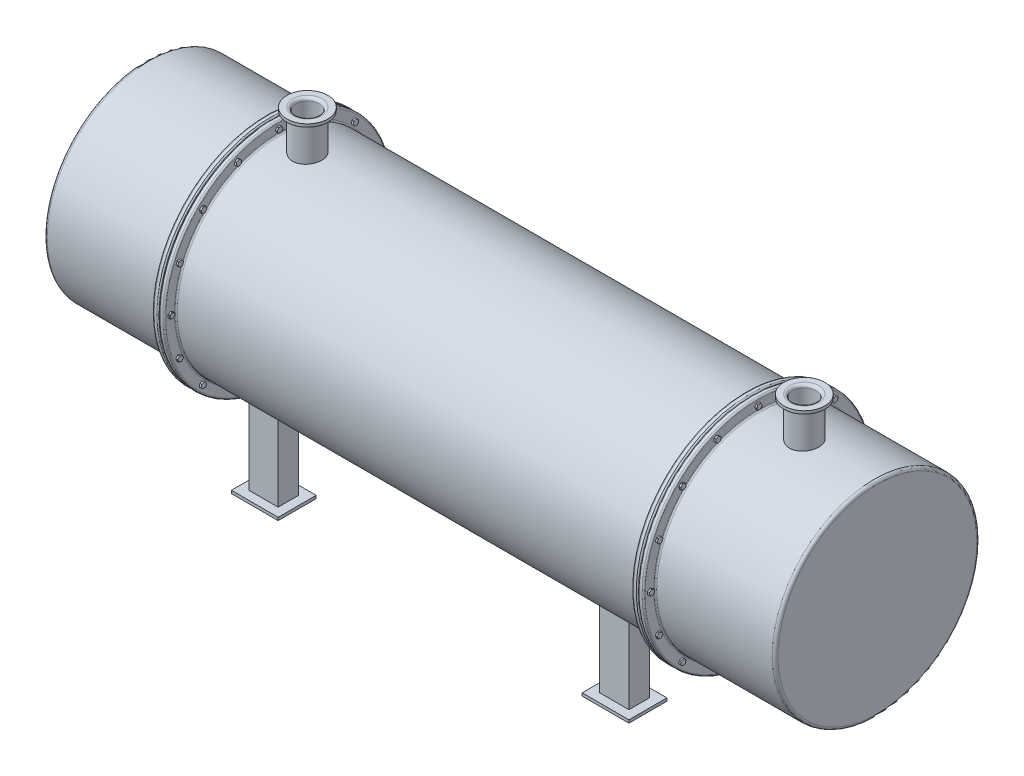
from build123d import *

# Parameters (mm, degrees)
BOSS_EXTRUDE1_DEPTH      = 1250
BOSS_EXTRUDE1_DEPTH_BACK = 1250
SKETCH1_R                = 350
BOSS_EXTRUDE2_START      = 800
SKETCH2_R                = 390
BOSS_EXTRUDE2_DEPTH      = 20
FILLET1_R                = 5
BOSS_EXTRUDE3_DEPTH      = 6
FILLET2_R                = 1
CIRPATTERN1_COUNT        = 16
MIRROR3_START            = 824.9999999
MIRROR3_OUTLINE_R        = 390
MIRROR3_DEPTH            = 10
MIRROR3_START_2          = 820
MIRROR3_2_DEPTH          = 26
FILLET4_R                = 10
SKETCH5_W                = 100
SKETCH5_H                = 70
BOSS_EXTRUDE4_DEPTH      = 503
SKETCH6_W                = 160
SKETCH6_H                = 130
BOSS_EXTRUDE5_DEPTH      = 10
MIRROR13_COPY_1_SKETCH_W = 100
MIRROR13_COPY_1_SKETCH_H = 70
MIRROR13_COPY_1_DEPTH    = 503
MIRROR13_COPY_2_SKETCH_W = 160
MIRROR13_COPY_2_SKETCH_H = 130
MIRROR13_COPY_2_DEPTH    = 10
SKETCH7_R                = 50
SKETCH7_R_2              = 40
BOSS_EXTRUDE6_DEPTH      = 472
SKETCH8_R                = 70
SKETCH8_R_2              = 40
BOSS_EXTRUDE7_DEPTH      = 10
FILLET5_R                = 10
FILLET5_OF_MIRROR18_R    = 10
SKETCH9_R                = 35
SKETCH9_R_2              = 25
BOSS_EXTRUDE8_DEPTH      = 476
SKETCH10_R               = 60
SKETCH10_R_2             = 50
BOSS_EXTRUDE9_DEPTH      = 450
SCALE2_SCALE             = 0.8


with BuildPart() as part:
    # Sketch1 → Boss-Extrude1 (new, two sides: drawn at the far end of the back side and taken through both)
    with BuildSketch(Plane(origin=(0, 0, 0), x_dir=(0, 0, -1), z_dir=(1, 0, 0)).offset(-BOSS_EXTRUDE1_DEPTH_BACK)):
        Circle(SKETCH1_R)
    extrude(amount=BOSS_EXTRUDE1_DEPTH + BOSS_EXTRUDE1_DEPTH_BACK)

    # Sketch2 → Boss-Extrude2 (add)
    with BuildSketch(Plane(origin=(0, 0, 0), x_dir=(0, 0, -1), z_dir=(1, 0, 0)).offset(BOSS_EXTRUDE2_START)):
        Circle(SKETCH2_R)
    extrude(amount=BOSS_EXTRUDE2_DEPTH)

    # Fillet1
    fillet1_edges = [part.edges().sort_by_distance(p)[0] for p in [
        (800, 0, 350),
        (800, 0, 390),
        (820, 0, 390),
    ]]
    fillet(fillet1_edges, radius=FILLET1_R)

    # Sketch4 → Boss-Extrude3 (add)
    with BuildSketch(Plane.ZY.offset(-800)):
        Polygon((376.160254038, -4.451318161), (376.160254038, 5.548681839), (367.5, 10.548681839), (358.839745962, 5.548681839), (358.839745962, -4.451318161), (367.5, -9.451318161), align=None)
    boss_extrude3 = extrude(amount=BOSS_EXTRUDE3_DEPTH)

    # Fillet2
    fillet2_edges = [part.edges().sort_by_distance(p)[0] for p in [
        (794, -6.951318161, 371.830127019),
        (794, 0.548681839, 376.160254038),
        (794, 8.048681839, 371.830127019),
        (794, 8.048681839, 363.169872981),
        (794, 0.548681839, 358.839745962),
        (794, -6.951318161, 363.169872981),
    ]]
    fillet(fillet2_edges, radius=FILLET2_R)

    # CirPattern1: Boss-Extrude3 ×16 about axis
    cirpattern1_axis = Axis((0, 0, 0), (1, 0, 0))
    for i in range(1, CIRPATTERN1_COUNT):
        add(boss_extrude3.rotate(cirpattern1_axis, i * 360 / CIRPATTERN1_COUNT))

    # Mirror3: read off the stored shape, not the designer's step
    # Mirror3 outline → Mirror3 (add)
    with BuildSketch(Plane.YZ.offset(MIRROR3_START)):
        Circle(MIRROR3_OUTLINE_R)
    extrude(amount=MIRROR3_DEPTH)

    # Mirror3 2 outline → Mirror3 2 (add)
    with BuildSketch(Plane.YZ.offset(MIRROR3_START_2)):
        Polygon((5.548681839, 376.160254038), (-4.451318161, 376.160254038), (-9.451318161, 367.5), (-4.451318161, 358.839745962), (5.548681839, 358.839745962), (10.548681839, 367.5), align=None)
        Polygon((-138.823983551, 349.650148261), (-148.062778876, 345.823313937), (-149.368040798, 335.908865324), (-141.434507395, 329.821251034), (-132.19571207, 333.648085357), (-130.890450148, 343.562533971), align=None)
        Polygon((-262.061955888, 269.908976998), (-269.1330237, 262.837909186), (-266.544833249, 253.178650923), (-256.885574986, 250.590460472), (-249.814507174, 257.661528284), (-252.402697625, 267.320786547), align=None)
        Polygon((-345.403371038, 149.076610718), (-349.230205362, 139.837815393), (-343.142591072, 131.90428199), (-333.228142458, 133.209543912), (-329.401308135, 142.448339237), (-335.488922425, 150.38187264), align=None)
        Polygon((-376.160254038, 5.548681839), (-376.160254038, -4.451318161), (-367.5, -9.451318161), (-358.839745962, -4.451318161), (-358.839745962, 5.548681839), (-367.5, 10.548681839), align=None)
        Polygon((-349.650148261, -138.823983551), (-345.823313937, -148.062778876), (-335.908865324, -149.368040798), (-329.821251034, -141.434507395), (-333.648085357, -132.19571207), (-343.562533971, -130.890450148), align=None)
        Polygon((-269.908976998, -262.061955888), (-262.837909186, -269.1330237), (-253.178650923, -266.544833249), (-250.590460472, -256.885574986), (-257.661528284, -249.814507174), (-267.320786547, -252.402697625), align=None)
        Polygon((-149.076610718, -345.403371038), (-139.837815393, -349.230205362), (-131.90428199, -343.142591072), (-133.209543912, -333.228142458), (-142.448339237, -329.401308135), (-150.38187264, -335.488922425), align=None)
        Polygon((-5.548681839, -376.160254038), (4.451318161, -376.160254038), (9.451318161, -367.5), (4.451318161, -358.839745962), (-5.548681839, -358.839745962), (-10.548681839, -367.5), align=None)
        Polygon((138.823983551, -349.650148261), (148.062778876, -345.823313937), (149.368040798, -335.908865324), (141.434507395, -329.821251034), (132.19571207, -333.648085357), (130.890450148, -343.562533971), align=None)
        Polygon((262.061955888, -269.908976998), (269.1330237, -262.837909186), (266.544833249, -253.178650923), (256.885574986, -250.590460472), (249.814507174, -257.661528284), (252.402697625, -267.320786547), align=None)
        Polygon((345.403371038, -149.076610718), (349.230205362, -139.837815393), (343.142591072, -131.90428199), (333.228142458, -133.209543912), (329.401308135, -142.448339237), (335.488922425, -150.38187264), align=None)
        Polygon((376.160254038, -5.548681839), (376.160254038, 4.451318161), (367.5, 9.451318161), (358.839745962, 4.451318161), (358.839745962, -5.548681839), (367.5, -10.548681839), align=None)
        Polygon((349.650148261, 138.823983551), (345.823313937, 148.062778876), (335.908865324, 149.368040798), (329.821251034, 141.434507395), (333.648085357, 132.19571207), (343.562533971, 130.890450148), align=None)
        Polygon((269.908976998, 262.061955888), (262.837909186, 269.1330237), (253.178650923, 266.544833249), (250.590460472, 256.885574986), (257.661528284, 249.814507174), (267.320786547, 252.402697625), align=None)
        Polygon((149.076610718, 345.403371038), (139.837815393, 349.230205362), (131.90428199, 343.142591072), (133.209543912, 333.228142458), (142.448339237, 329.401308135), (150.38187264, 335.488922425), align=None)
    extrude(amount=MIRROR3_2_DEPTH)

    # Mirror3 3 outline → Mirror3 3 (revolve)
    with BuildSketch(Plane.YX):
        with BuildLine():
            Line((385, 840), (355, 840))
            ThreePointArc((355, 840), (351.464466094, 841.464466094), (350, 845))
            Line((350, 845), (350, 834.9999999))
            Line((350, 834.9999999), (390, 835))
            ThreePointArc((390, 835), (388.535533906, 838.535533906), (385, 840))
        make_face()
        with BuildLine():
            ThreePointArc((385, 820), (388.535533906, 821.464466094), (390, 825))
            Line((390, 825), (350, 824.9999999))
            Line((350, 824.9999999), (350, 820))
            Line((350, 820), (385, 820))
        make_face()
    revolve(axis=Axis((0, 0, 0), (1, 0, 0)))

    # Fillet4
    fillet4_edges = [part.edges().sort_by_distance(p)[0] for p in [
        (-1250, 0, 350),
        (1250, 0, 350),
    ]]
    fillet(fillet4_edges, radius=FILLET4_R)

    # Sketch5 → Boss-Extrude4 (add)
    with BuildSketch(Plane(origin=(0, 0, 0), x_dir=(1, 0, 0), z_dir=(0, 1, 0))):
        with Locations((600, -215)):
            Rectangle(SKETCH5_W, SKETCH5_H)
    boss_extrude4 = extrude(amount=-BOSS_EXTRUDE4_DEPTH)

    # Sketch6 → Boss-Extrude5 (add)
    with BuildSketch(Plane.XZ.offset(503)):
        with Locations((600, 215)):
            Rectangle(SKETCH6_W, SKETCH6_H)
    boss_extrude5 = extrude(amount=BOSS_EXTRUDE5_DEPTH)

    # Mirror4: Boss-Extrude4, Boss-Extrude5 across plane
    add(boss_extrude4.mirror(Plane.XY))
    add(boss_extrude5.mirror(Plane.XY))

    # Mirror13: Boss-Extrude4, Boss-Extrude5 across plane
    add(boss_extrude4.mirror(Plane(origin=(0, 0, 0), x_dir=(0, 0, 1), z_dir=(1, 0, 0))))
    add(boss_extrude5.mirror(Plane(origin=(0, 0, 0), x_dir=(0, 0, 1), z_dir=(1, 0, 0))))

    # Mirror13 copy 1 sketch → Mirror13 copy 1 (add)
    with BuildSketch(Plane(origin=(0, 0, 0), x_dir=(-1, 0, 0), z_dir=(0, 1, 0))):
        with Locations((600, -215)):
            Rectangle(MIRROR13_COPY_1_SKETCH_W, MIRROR13_COPY_1_SKETCH_H)
    extrude(amount=-MIRROR13_COPY_1_DEPTH)

    # Mirror13 copy 2 sketch → Mirror13 copy 2 (add)
    with BuildSketch(Plane(origin=(0, -503, 0), x_dir=(-1, 0, 0), z_dir=(0, -1, 0))):
        with Locations((600, 215)):
            Rectangle(MIRROR13_COPY_2_SKETCH_W, MIRROR13_COPY_2_SKETCH_H)
    extrude(amount=MIRROR13_COPY_2_DEPTH)

    # Mirror17: read off the stored shape, not the designer's step
    # Mirror17: part across plane


with BuildPart() as part_1:
    add(part.part)
    add(part.part.mirror(Plane(origin=(0, 0, 0), x_dir=(0, 0, 1), z_dir=(1, 0, 0))))

    # Sketch7 → Boss-Extrude6 (add)
    with BuildSketch(Plane(origin=(0, 0, 0), x_dir=(1, 0, 0), z_dir=(0, 1, 0))):
        with Locations(Location((1000, 0, 0), (0, 0, 90))):
            Circle(SKETCH7_R)
        with Locations(Location((1000, 0, 0), (0, 0, 90))):
            Circle(SKETCH7_R_2, mode=Mode.SUBTRACT)
    boss_extrude6 = extrude(amount=BOSS_EXTRUDE6_DEPTH)

    # Sketch8 → Boss-Extrude7 (add)
    with BuildSketch(Plane(origin=(0, 472, 0), x_dir=(1, 0, 0), z_dir=(0, 1, 0))):
        with Locations(Location((1000, 0, 0), (0, 0, 270))):
            Circle(SKETCH8_R)
        with Locations(Location((1000, 0, 0), (0, 0, 90))):
            Circle(SKETCH8_R_2, mode=Mode.SUBTRACT)
    boss_extrude7 = extrude(amount=BOSS_EXTRUDE7_DEPTH)

    # Fillet5
    fillet5_edges = [part_1.edges().sort_by_distance(p)[0] for p in [
        (1000, 482, 40),
    ]]
    fillet(fillet5_edges, radius=FILLET5_R)

    # Mirror18: Boss-Extrude6, Boss-Extrude7 across plane
    add(boss_extrude6.mirror(Plane.ZY.offset(-150)))
    add(boss_extrude7.mirror(Plane.ZY.offset(-150)))

    # Fillet5 of Mirror18
    fillet5_of_mirror18_edges = [part_1.edges().sort_by_distance(p)[0] for p in [
        (-700, 482, 40),
    ]]
    fillet(fillet5_of_mirror18_edges, radius=FILLET5_OF_MIRROR18_R)

    # Sketch9 → Boss-Extrude8 (add)
    with BuildSketch(Plane(origin=(0, 0, 0), x_dir=(1, 0, 0), z_dir=(0, 1, 0))):
        with Locations(Location((-1000, 0, 0), (0, 0, 270))):
            Circle(SKETCH9_R)
        with Locations(Location((-1000, 0, 0), (0, 0, 270))):
            Circle(SKETCH9_R_2, mode=Mode.SUBTRACT)
    extrude(amount=-BOSS_EXTRUDE8_DEPTH)

    # Sketch10 → Boss-Extrude9 (add)
    with BuildSketch(Plane(origin=(0, 0, 0), x_dir=(1, 0, 0), z_dir=(0, 1, 0))):
        with Locations(Location((500, 0, 0), (0, 0, 270))):
            Circle(SKETCH10_R)
        with Locations(Location((500, 0, 0), (0, 0, 270))):
            Circle(SKETCH10_R_2, mode=Mode.SUBTRACT)
    extrude(amount=-BOSS_EXTRUDE9_DEPTH)


with BuildPart() as part_2:
    # Scale2: scaled about (0, 0, 0)
    add(part_1.part.scale(SCALE2_SCALE))


solid = part_2.part
